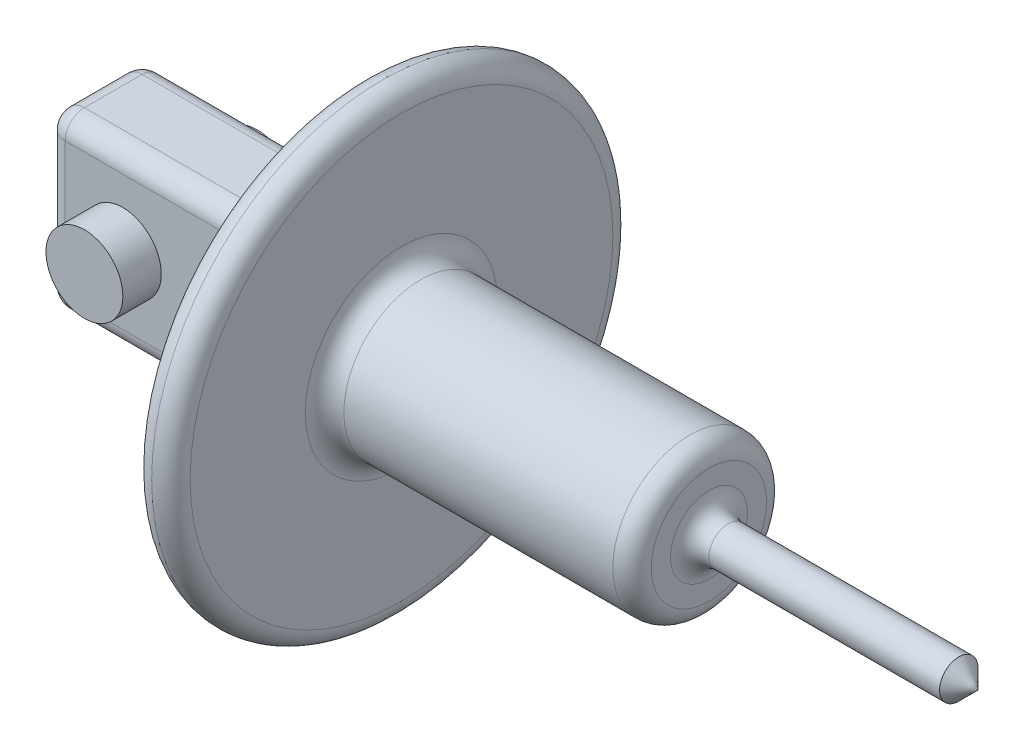
from build123d import *

# Parameters (mm, degrees)
SKETCH1_R             = 60
SKETCH1_W             = 25
SKETCH1_H             = 45
BOSS_EXTRUDE1_DEPTH   = 10
SKETCH1_3_R           = 20
BOSS_EXTRUDE2_DEPTH   = 80
BOSS_EXTRUDE3_START   = -80
SKETCH1_4_R           = 5
BOSS_EXTRUDE3_DEPTH   = 70
CHAMFER1_SIZE         = 5
SKETCH1_5_W           = 25
SKETCH1_5_H           = 45
BOSS_EXTRUDE4_DEPTH   = 80
SKETCH3_R             = 10
BOSS_EXTRUDE5_DEPTH   = 10
FILLET1_R             = 5
BODY_MOVE_COPY4_ANGLE = 180


with BuildPart() as part:
    # Sketch1 → Boss-Extrude1 (new body)
    with BuildSketch(Plane(origin=(0, 0, 0), x_dir=(0, 0, -1), z_dir=(1, 0, 0))):
        Circle(SKETCH1_R)
        Rectangle(SKETCH1_W, SKETCH1_H, mode=Mode.SUBTRACT)
    extrude(amount=BOSS_EXTRUDE1_DEPTH)

    # Sketch1<3> → Boss-Extrude2 (add)
    with BuildSketch(Plane(origin=(0, 0, 0), x_dir=(0, 0, -1), z_dir=(1, 0, 0))):
        Circle(SKETCH1_3_R)
    extrude(amount=-BOSS_EXTRUDE2_DEPTH)

    # Sketch1<4> → Boss-Extrude3 (add)
    with BuildSketch(Plane(origin=(0, 0, 0), x_dir=(0, 0, -1), z_dir=(1, 0, 0)).offset(BOSS_EXTRUDE3_START)):
        Circle(SKETCH1_4_R)
    extrude(amount=-BOSS_EXTRUDE3_DEPTH)

    # Chamfer1
    chamfer1_edges = [part.edges().sort_by_distance(p)[0] for p in [
        (-150, 0, 5),
    ]]
    chamfer(chamfer1_edges, length=CHAMFER1_SIZE)

    # Sketch1<5> → Boss-Extrude4 (add)
    with BuildSketch(Plane(origin=(0, 0, 0), x_dir=(0, 0, -1), z_dir=(1, 0, 0))):
        Rectangle(SKETCH1_5_W, SKETCH1_5_H)
    extrude(amount=BOSS_EXTRUDE4_DEPTH)

    # Sketch3 → Boss-Extrude5 (add)
    with BuildSketch(Plane(origin=(0, 0, -12.5), x_dir=(-1, 0, 0), z_dir=(0, 0, -1))):
        with Locations(Location((-60, 0, 0), (0, 0, 90))):
            Circle(SKETCH3_R)
    boss_extrude5 = extrude(amount=BOSS_EXTRUDE5_DEPTH)

    # Mirror1: Boss-Extrude5 across plane
    add(boss_extrude5.mirror(Plane.XY))

    # Fillet1
    fillet1_edges = [part.edges().sort_by_distance(p)[0] for p in [
        (10, 22.5, 0),
        (10, 0, -12.5),
        (0, 0, 20),
        (-80, 0, 20),
        (10, 0, 60),
        (-80, 0, 5),
        (45, 22.5, 12.5),
        (45, -22.5, 12.5),
        (45, -22.5, -12.5),
        (80, 0, -12.5),
        (45, 22.5, -12.5),
        (80, 22.5, 0),
        (80, 0, 12.5),
        (80, -22.5, 0),
        (10, -22.5, 0),
        (0, 0, 60),
        (10, 0, 12.5),
    ]]
    fillet(fillet1_edges, radius=FILLET1_R - 0.0001)  # a hair under: the kernel refuses the full size


with BuildPart() as part_1:
    # Body-Move/Copy1: moved
    add(part.part.moved(Location((150, 0, 0))))


with BuildPart() as part_2:
    # Body-Move/Copy4: moved
    add(part_1.part.rotate(Axis((0, 0, 0), (0, 1, 0)), BODY_MOVE_COPY4_ANGLE))


with BuildPart() as part_3:
    # Body-Move/Copy5: moved
    add(part_2.part.moved(Location((210, 0, 0))))


solid = part_3.part
